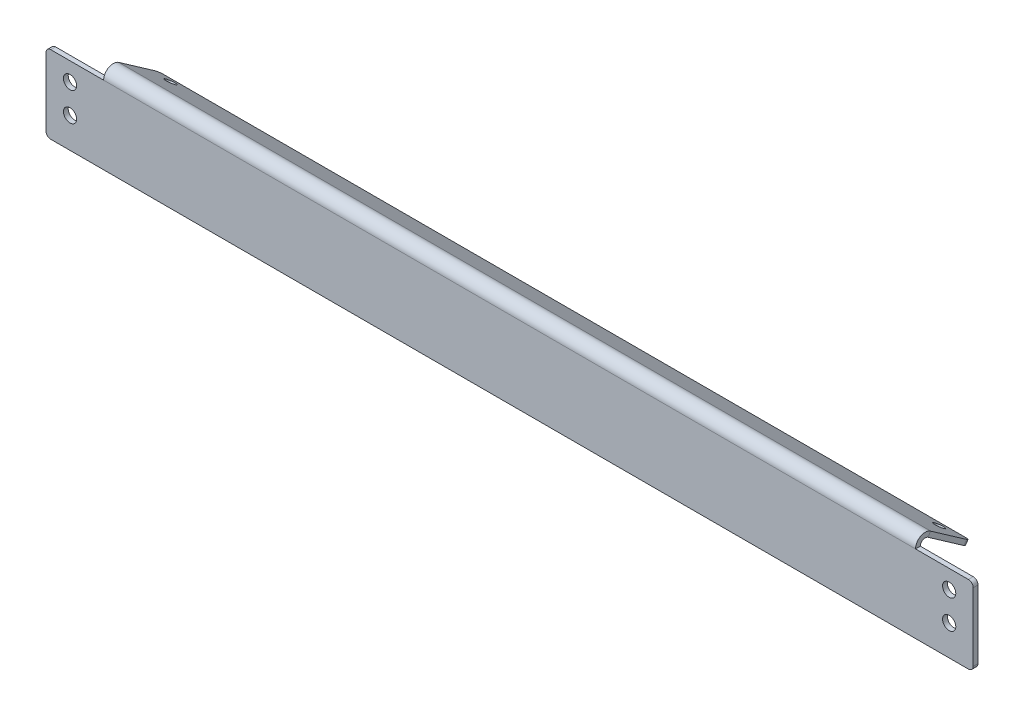
from build123d import *

# Parameters (mm, degrees)
BASE_FLANGE1_DEPTH       = 612.775
CUT_EXTRUDE1_OUTLINE_W   = 38.1
CUT_EXTRUDE1_OUTLINE_H   = 57.651763494
CUT_EXTRUDE1_DEPTH       = 33.236308369
CUT_EXTRUDE1_START       = -3.175
CUT_EXTRUDE1_2_OUTLINE_W = 38.1
CUT_EXTRUDE1_2_OUTLINE_H = 6.35
CUT_EXTRUDE1_2_DEPTH     = 3.175
SKETCH7_R                = 4.3688
CUT_EXTRUDE2_DEPTH       = 3.175
SKETCH8_R                = 3.429
CUT_EXTRUDE3_DEPTH       = 3.175
FILLET1_R                = 3.175


# Read off the part's stored shape, not the designer's step: Cut-Extrude1
# Sheet-metal steps are written as plain solids
with BuildPart() as part:
    # Sketch1 → Base-Flange1 (new body)
    with BuildSketch(Plane(origin=(0, 0, 0), x_dir=(0, 0, -1), z_dir=(1, 0, 0))):
        with BuildLine():
            Line((0, 0), (0, 51.301763494))
            ThreePointArc((0, 51.301763494), (3.417896306, 56.934282284), (9.992210371, 56.503378975))
            Line((9.992210371, 56.503378975), (36.411308369, 38.004527404))
            Line((36.411308369, 38.004527404), (34.590203183, 35.403719664))
            Line((34.590203183, 35.403719664), (8.171105185, 53.902571234))
            ThreePointArc((8.171105185, 53.902571234), (4.883948153, 54.118022889), (3.175, 51.301763494))
            Line((3.175, 51.301763494), (3.175, 0))
            Line((3.175, 0), (0, 0))
        make_face()
    extrude(amount=BASE_FLANGE1_DEPTH)

    # Cut-Extrude1 outline → Cut-Extrude1 (cut)
    with BuildSketch(Plane(origin=(0, 0, -3.175), x_dir=(-1, 0, 0), z_dir=(0, 0, -1))):
        with Locations((-593.725, 28.825881747)):
            Rectangle(CUT_EXTRUDE1_OUTLINE_W, CUT_EXTRUDE1_OUTLINE_H)
        with Locations((-19.05, 28.825881747)):
            Rectangle(CUT_EXTRUDE1_OUTLINE_W, CUT_EXTRUDE1_OUTLINE_H)
    extrude(amount=CUT_EXTRUDE1_DEPTH, mode=Mode.SUBTRACT)

    # Cut-Extrude1 2 outline → Cut-Extrude1 2 (cut)
    with BuildSketch(Plane(origin=(0, 0, -3.175), x_dir=(-1, 0, 0), z_dir=(0, 0, -1)).offset(CUT_EXTRUDE1_START)):
        with Locations((-593.725, 54.476763494)):
            Rectangle(CUT_EXTRUDE1_2_OUTLINE_W, CUT_EXTRUDE1_2_OUTLINE_H)
        with Locations((-19.05, 54.476763494)):
            Rectangle(CUT_EXTRUDE1_2_OUTLINE_W, CUT_EXTRUDE1_2_OUTLINE_H)
    extrude(amount=CUT_EXTRUDE1_2_DEPTH, mode=Mode.SUBTRACT)

    # Sketch7 → Cut-Extrude2 (cut)
    with BuildSketch(Plane.XY):
        with Locations((15.875, 39.109763494)):
            Circle(SKETCH7_R)
        with Locations((15.875, 20.059763494)):
            Circle(SKETCH7_R)
        with Locations((596.9, 39.109763494)):
            Circle(SKETCH7_R)
        with Locations((596.9, 20.059763494)):
            Circle(SKETCH7_R)
    extrude(amount=-CUT_EXTRUDE2_DEPTH, mode=Mode.SUBTRACT)

    # Sketch8 → Cut-Extrude3 (cut)
    with BuildSketch(Plane(origin=(0, 42.609139551, -29.83524071), x_dir=(1, 0, 0), z_dir=(0, 0.819152044288989, -0.5735764363510502))):
        with Locations(Location((560.3875, 0.090396292, 0), (0, 0, 270))):
            Circle(SKETCH8_R)
        with Locations(Location((52.3875, 0.090396292, 0), (0, 0, 270))):
            Circle(SKETCH8_R)
    extrude(amount=-CUT_EXTRUDE3_DEPTH, mode=Mode.SUBTRACT)

    # Fillet1
    fillet1_edges = [part.edges().sort_by_distance(p)[0] for p in [
        (0, 51.301763494, -1.5875),
        (612.775, 51.301763494, -1.5875),
        (612.775, 0, -1.5875),
        (38.1, 36.704123534, -35.500755776),
        (574.675, 36.704123534, -35.500755776),
        (0, 0, -1.5875),
    ]]
    fillet(fillet1_edges, radius=FILLET1_R)


solid = part.part
